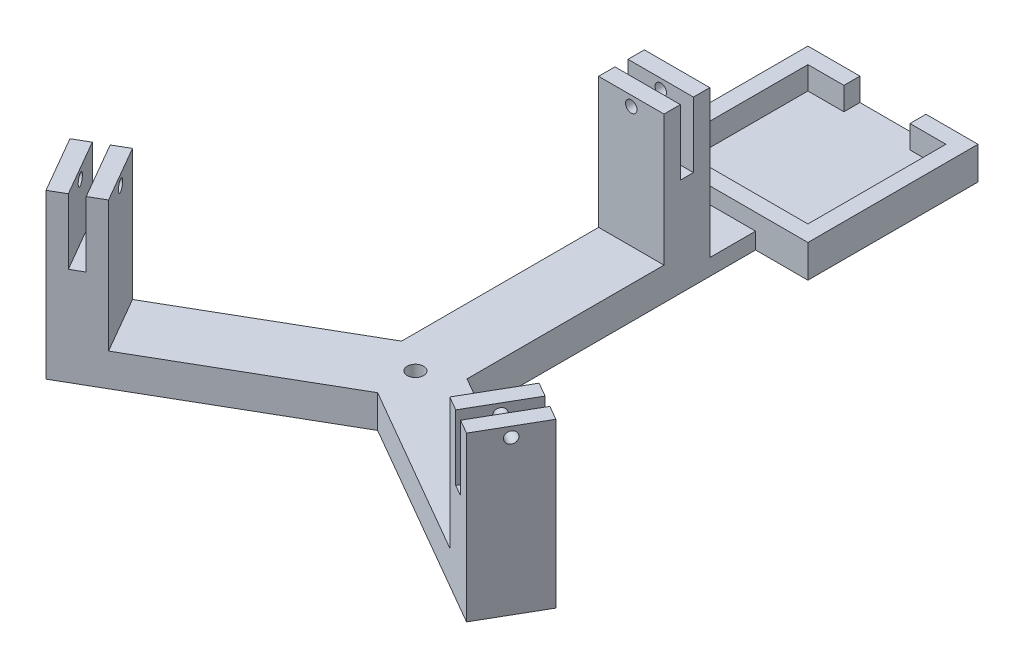
from build123d import *

# Parameters (mm, degrees)
BOSS_EXTRUDE1_DEPTH = 10
SKETCH2_W           = 20
SKETCH2_H           = 14
BOSS_EXTRUDE2_DEPTH = 20
SKETCH3_W           = 20
SKETCH3_H           = 5
BOSS_EXTRUDE3_DEPTH = 20
SKETCH4_R           = 1.75
CUT_EXTRUDE1_DEPTH  = 84.402637848
CIRPATTERN1_COUNT   = 3
SKETCH5_R           = 2.5
CUT_EXTRUDE2_DEPTH  = 117.266161556
SKETCH8_W           = 20
SKETCH8_H           = 14
BOSS_EXTRUDE7_DEPTH = 5
SKETCH11_W          = 52
SKETCH11_H          = 52
BOSS_EXTRUDE8_DEPTH = 10
CUT_EXTRUDE3_DEPTH  = 7


with BuildPart() as part:
    # Sketch1 → Boss-Extrude1 (new body)
    with BuildSketch(Plane(origin=(0, 0, 0), x_dir=(1, 0, 0), z_dir=(0, 1, 0))):
        Polygon((0, 0), (-10, 5.773502692), (-10, 80), (10, 80), (10, 5.773502692), align=None)
    boss_extrude1 = extrude(amount=BOSS_EXTRUDE1_DEPTH)

    # Sketch2 → Boss-Extrude2 (add)
    with BuildSketch(Plane(origin=(0, 10, 0), x_dir=(1, 0, 0), z_dir=(0, 1, 0))):
        with Locations((0, 73)):
            Rectangle(SKETCH2_W, SKETCH2_H)
    boss_extrude2 = extrude(amount=BOSS_EXTRUDE2_DEPTH)

    # Sketch3 → Boss-Extrude3 (add)
    with BuildSketch(Plane(origin=(0, 30, 0), x_dir=(1, 0, 0), z_dir=(0, 1, 0))):
        with Locations((0, 77.5)):
            Rectangle(SKETCH3_W, SKETCH3_H)
        with Locations((0, 68.5)):
            Rectangle(SKETCH3_W, SKETCH3_H)
    boss_extrude3 = extrude(amount=BOSS_EXTRUDE3_DEPTH)

    # Sketch4 → Cut-Extrude1 (cut, symmetric)
    with BuildSketch(Plane.XY.offset(-66)):
        with Locations((0, 47)):
            Circle(SKETCH4_R)
    cut_extrude1 = extrude(amount=CUT_EXTRUDE1_DEPTH, both=True, mode=Mode.SUBTRACT)

    # CirPattern1: Boss-Extrude1, Boss-Extrude2, Boss-Extrude3, Cut-Extrude1 ×3 about axis
    cirpattern1_axis = Axis((0, 10, 0), (0, -1, 0))
    add([boss_extrude1.rotate(cirpattern1_axis, i * 360 / CIRPATTERN1_COUNT) for i in range(1, CIRPATTERN1_COUNT)])
    add([boss_extrude2.rotate(cirpattern1_axis, i * 360 / CIRPATTERN1_COUNT) for i in range(1, CIRPATTERN1_COUNT)])
    add([boss_extrude3.rotate(cirpattern1_axis, i * 360 / CIRPATTERN1_COUNT) for i in range(1, CIRPATTERN1_COUNT)])
    add([cut_extrude1.rotate(cirpattern1_axis, i * 360 / CIRPATTERN1_COUNT) for i in range(1, CIRPATTERN1_COUNT)], mode=Mode.SUBTRACT)

    # Sketch5 → Cut-Extrude2 (cut, through all)
    with BuildSketch(Plane(origin=(0, 10, 0), x_dir=(1, 0, 0), z_dir=(0, 1, 0))):
        Circle(SKETCH5_R)
    extrude(amount=-CUT_EXTRUDE2_DEPTH, mode=Mode.SUBTRACT)

    # Sketch8 → Boss-Extrude7 (add)
    with BuildSketch(Plane(origin=(0, 0, 0), x_dir=(1, 0, 0), z_dir=(0, 1, 0))):
        with Locations((0, 87)):
            Rectangle(SKETCH8_W, SKETCH8_H)
    extrude(amount=BOSS_EXTRUDE7_DEPTH)

    # Sketch11 → Boss-Extrude8 (add)
    with BuildSketch(Plane(origin=(0, 0, 0), x_dir=(1, 0, 0), z_dir=(0, 1, 0))):
        with Locations((0, 120)):
            Rectangle(SKETCH11_W, SKETCH11_H)
    extrude(amount=BOSS_EXTRUDE8_DEPTH)

    # Sketch12 → Cut-Extrude3 (cut)
    with BuildSketch(Plane(origin=(0, 10, 0), x_dir=(1, 0, 0), z_dir=(0, 1, 0))):
        Polygon((-21.1, 141.1), (-10.1, 141.1), (-10.1, 146), (10.1, 146), (10.1, 141.1), (21.1, 141.1), (21.1, 98.9), (-21.1, 98.9), align=None)
    extrude(amount=-CUT_EXTRUDE3_DEPTH, mode=Mode.SUBTRACT)


solid = part.part
